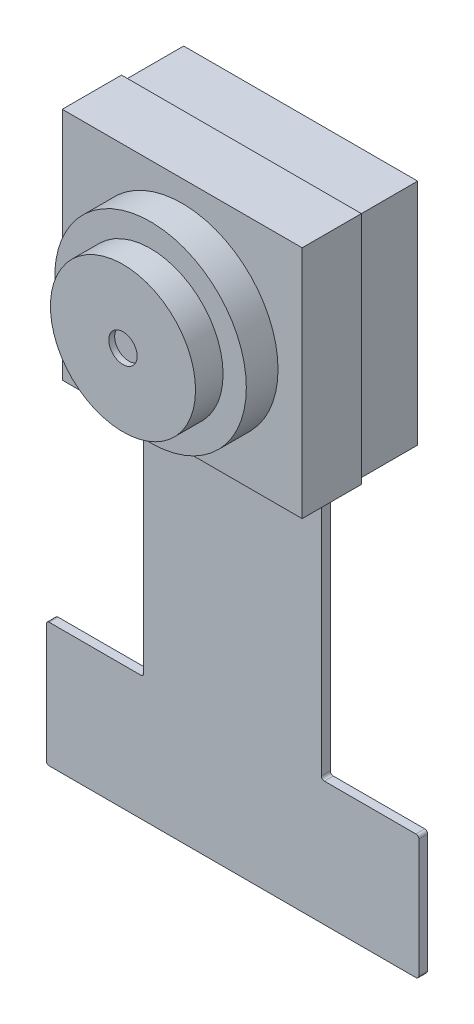
from build123d import *

# Parameters (mm, degrees)
SKETCH1_W           = 8.1
SKETCH1_H           = 7.92
BOSS_EXTRUDE1_DEPTH = 6
SKETCH2_W           = 8.1
SKETCH2_H           = 7.92
SKETCH2_R           = 3.235
CUT_EXTRUDE1_DEPTH  = 2
SKETCH3_R           = 3.235
SKETCH3_R_2         = 2.45
CUT_EXTRUDE2_DEPTH  = 0.93
SKETCH4_R           = 0.48
CUT_EXTRUDE3_DEPTH  = 0.2
SKETCH5_W           = 8.1
SKETCH5_H           = 7.92
SKETCH5_W_2         = 7.9
SKETCH5_H_2         = 7.72
CUT_EXTRUDE4_DEPTH  = 2
BOSS_EXTRUDE2_DEPTH = 0.3
CUT_EXTRUDE5_DEPTH  = 0.01
FILLET1_R           = 0.1


with BuildPart() as part:
    # Sketch1 → Boss-Extrude1 (new body)
    with BuildSketch(Plane.XY):
        Rectangle(SKETCH1_W, SKETCH1_H)
    extrude(amount=BOSS_EXTRUDE1_DEPTH)

    # Sketch2 → Cut-Extrude1 (cut)
    with BuildSketch(Plane.XY.offset(6)):
        Rectangle(SKETCH2_W, SKETCH2_H)
        Circle(SKETCH2_R, mode=Mode.SUBTRACT)
    extrude(amount=-CUT_EXTRUDE1_DEPTH, mode=Mode.SUBTRACT)

    # Sketch3 → Cut-Extrude2 (cut)
    with BuildSketch(Plane.XY.offset(6)):
        Circle(SKETCH3_R)
        Circle(SKETCH3_R_2, mode=Mode.SUBTRACT)
    extrude(amount=-CUT_EXTRUDE2_DEPTH, mode=Mode.SUBTRACT)

    # Sketch4 → Cut-Extrude3 (cut)
    with BuildSketch(Plane.XY.offset(6)):
        Circle(SKETCH4_R)
    extrude(amount=-CUT_EXTRUDE3_DEPTH, mode=Mode.SUBTRACT)

    # Sketch5 → Cut-Extrude4 (cut)
    with BuildSketch(Plane(origin=(0, 0, 0), x_dir=(-1, 0, 0), z_dir=(0, 0, -1))):
        Rectangle(SKETCH5_W, SKETCH5_H)
        Rectangle(SKETCH5_W_2, SKETCH5_H_2, mode=Mode.SUBTRACT)
    extrude(amount=-CUT_EXTRUDE4_DEPTH, mode=Mode.SUBTRACT)

    # Sketch6 → Boss-Extrude2 (add)
    with BuildSketch(Plane(origin=(0, 0, 2), x_dir=(-1, 0, 0), z_dir=(0, 0, -1))):
        Polygon((-3, -17.16), (3, -17.16), (6.29, -17.16), (6.29, -12.96), (3, -12.96), (3, -3.96), (-3, -3.96), (-3, -12.96), (-6.29, -12.96), (-6.29, -17.16), align=None)
    extrude(amount=-BOSS_EXTRUDE2_DEPTH)

    # Sketch7 → Cut-Extrude5 (cut)
    with BuildSketch(Plane(origin=(0, 0, 2), x_dir=(-1, 0, 0), z_dir=(0, 0, -1))):
        Polygon((6.29, -14.61), (-6.29, -14.61), (-6.29, -17.16), (-5.95, -17.16), (-5.95, -14.62), (-5.55, -14.62), (-5.55, -17.16), (-5.45, -17.16), (-5.45, -14.62), (-5.05, -14.62), (-5.05, -17.16), (-4.95, -17.16), (-4.95, -14.62), (-4.55, -14.62), (-4.55, -17.16), (-4.45, -17.16), (-4.45, -14.62), (-4.05, -14.62), (-4.05, -17.16), (-3.95, -17.16), (-3.95, -14.62), (-3.55, -14.62), (-3.55, -17.16), (-3.45, -17.16), (-3.45, -14.62), (-3.05, -14.62), (-3.05, -17.16), (-2.95, -17.16), (-2.95, -14.62), (-2.55, -14.62), (-2.55, -17.16), (-2.45, -17.16), (-2.45, -14.62), (-2.05, -14.62), (-2.05, -17.16), (-1.95, -17.16), (-1.95, -14.62), (-1.55, -14.62), (-1.55, -17.16), (-1.45, -17.16), (-1.45, -14.62), (-1.05, -14.62), (-1.05, -17.16), (-0.95, -17.16), (-0.95, -14.62), (-0.55, -14.62), (-0.55, -17.16), (-0.45, -17.16), (-0.45, -14.62), (-0.05, -14.62), (-0.05, -17.16), (0.05, -17.16), (0.05, -14.62), (0.45, -14.62), (0.45, -17.16), (0.55, -17.16), (0.55, -14.62), (0.95, -14.62), (0.95, -17.16), (1.05, -17.16), (1.05, -14.62), (1.45, -14.62), (1.45, -17.16), (1.55, -17.16), (1.55, -14.62), (1.95, -14.62), (1.95, -17.16), (2.05, -17.16), (2.05, -14.62), (2.45, -14.62), (2.45, -17.16), (2.55, -17.16), (2.55, -14.62), (2.95, -14.62), (2.95, -17.16), (3.05, -17.16), (3.05, -14.62), (3.45, -14.62), (3.45, -17.16), (3.55, -17.16), (3.55, -14.62), (3.95, -14.62), (3.95, -17.16), (4.05, -17.16), (4.05, -14.62), (4.45, -14.62), (4.45, -17.16), (4.55, -17.16), (4.55, -14.62), (4.95, -14.62), (4.95, -17.16), (5.05, -17.16), (5.05, -14.62), (5.45, -14.62), (5.45, -17.16), (5.55, -17.16), (5.55, -14.62), (5.95, -14.62), (5.95, -17.16), (6.29, -17.16), align=None)
    extrude(amount=-CUT_EXTRUDE5_DEPTH, mode=Mode.SUBTRACT)

    # Fillet1
    fillet1_edges = [part.edges().sort_by_distance(p)[0] for p in [
        (-6.29, -17.16, 2.155),
        (6.29, -17.16, 2.155),
        (3, -12.96, 2.15),
        (-3, -12.96, 2.15),
        (-6.29, -12.96, 2.15),
        (6.29, -12.96, 2.15),
    ]]
    fillet(fillet1_edges, radius=FILLET1_R)


solid = part.part
